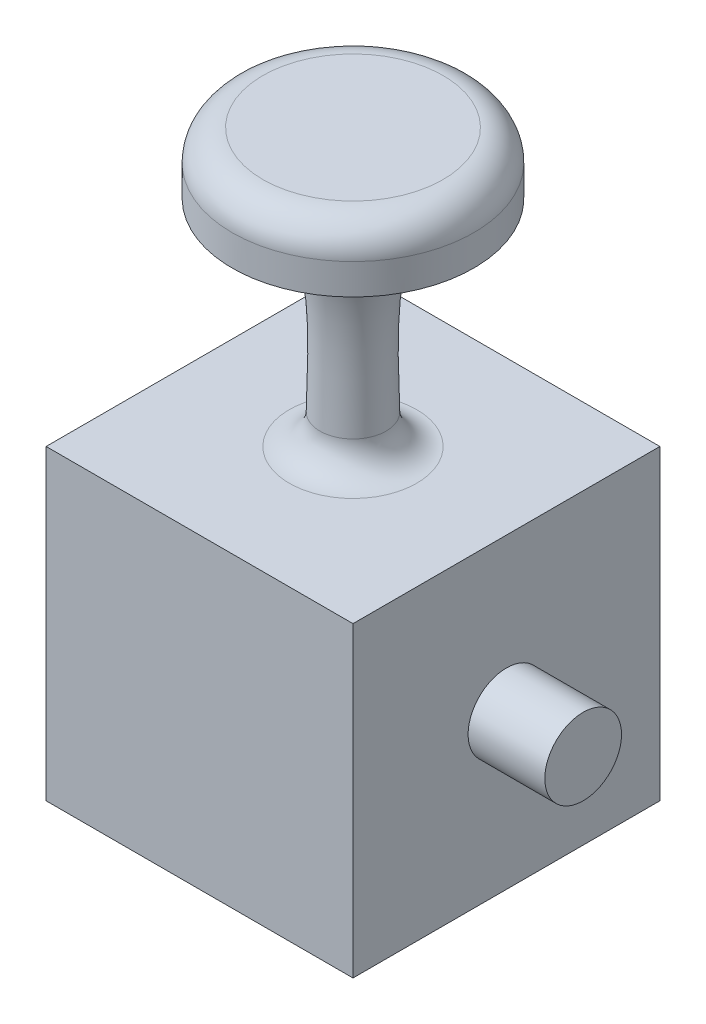
from build123d import *

# Parameters (mm, degrees)
SKETCH2_W          = 25.4
SKETCH2_H          = 25.4
CENTRAL_BOX_DEPTH  = 25.4
NIBBLES_DEPTH      = 6.35
NIBBLES_DEPTH_BACK = 31.75
SKETCH4_R          = 3.175
YAY_ROUNDED_R      = 2.54


with BuildPart() as part:
    # Sketch2 → central box (new body)
    with BuildSketch(Plane(origin=(0, 0, 0), x_dir=(0, 0, -1), z_dir=(1, 0, 0))):
        with Locations((12.7, 12.7)):
            Rectangle(SKETCH2_W, SKETCH2_H)
    extrude(amount=CENTRAL_BOX_DEPTH)

    # Sketch4 → nibbles (add, two sides: drawn at the far end of the back side and taken through both)
    with BuildSketch(Plane(origin=(25.4, 0, 0), x_dir=(0, 0, -1), z_dir=(1, 0, 0)).offset(-NIBBLES_DEPTH_BACK)):
        with Locations((12.7, 12.7)):
            Circle(SKETCH4_R)
    extrude(amount=NIBBLES_DEPTH + NIBBLES_DEPTH_BACK)

    # Sketch6 → stick (revolve)
    with BuildSketch(Plane.XY.offset(-12.7)):
        with BuildLine():
            Line((12.7, 25.4), (12.7, 48.26))
            Line((12.7, 48.26), (22.69993783, 48.26))
            Line((22.69993783, 48.26), (22.69993783, 43.18))
            add(Edge.make_bspline(
                [(22.69993783, 43.18), (13.97623208, 45.662332969), (15.384638843, 33.948226223), (15.494, 25.4)],
                knots=[0, 0, 0, 0, 1, 1, 1, 1], degree=3))
            Line((15.494, 25.4), (12.7, 25.4))
        make_face()
    revolve(axis=Axis((12.7, 25.4, -12.7), (0, 1, 0)))

    # yay, rounded
    yay_rounded_edges = [part.edges().sort_by_distance(p)[0] for p in [
        (9.906, 25.4, -12.7),
        (2.70006217, 48.26, -12.7),
    ]]
    fillet(yay_rounded_edges, radius=YAY_ROUNDED_R)


solid = part.part
